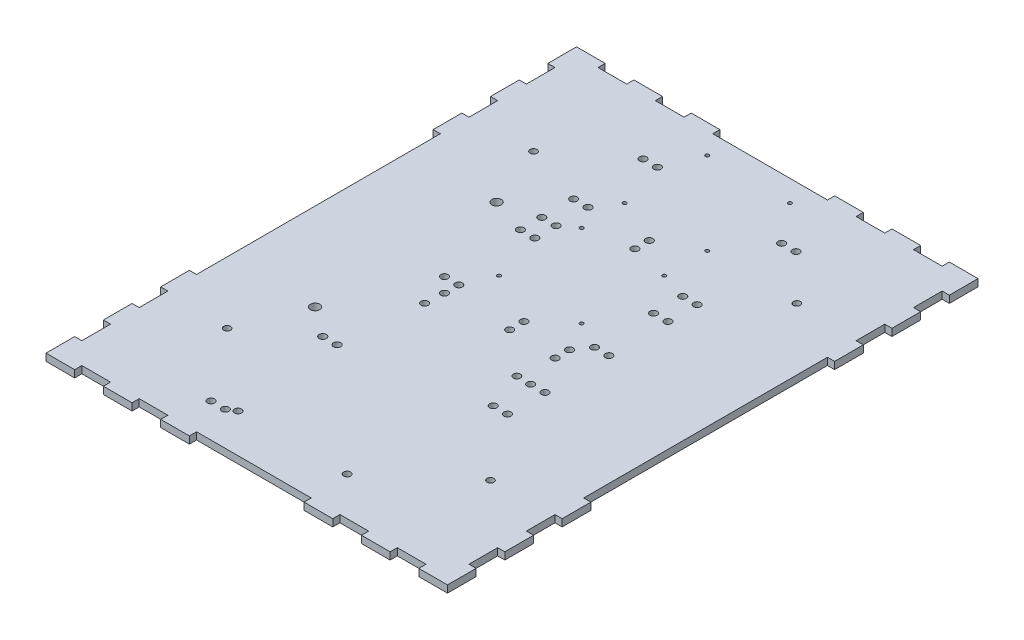
from build123d import *

# Parameters (mm, degrees)
BOSS_EXTRUDE1_DEPTH     = 3.175
CUT_EXTRUDE1_DEPTH      = 295.659843082
CUT_EXTRUDE1_DEPTH_BACK = 3.175
SKETCH2_R               = 1.524
SKETCH3_R               = 0.8
CUT_EXTRUDE2_DEPTH      = 5.715
SKETCH4_R               = 1.5621
CUT_EXTRUDE3_DEPTH      = 10.16
SKETCH5_W               = 50.8
SKETCH5_H               = 3.175
SKETCH5_W_2             = 12.7
CUT_EXTRUDE4_DEPTH      = 7.62
SKETCH7_R               = 2.0955
CUT_EXTRUDE5_DEPTH      = 7.62
SKETCH17_R              = 1.5875
CUT_EXTRUDE6_DEPTH      = 2.54


with BuildPart() as part:
    # Sketch1 → Boss-Extrude1 (new body)
    with BuildSketch(Plane(origin=(0, 0, 0), x_dir=(1, 0, 0), z_dir=(0, 1, 0))):
        Polygon((3.175, 209.55), (0, 209.55), (0, 196.85), (3.175, 196.85), (3.175, 184.15), (0, 184.15), (0, 171.45), (3.175, 171.45), (3.175, 63.5), (0, 63.5), (0, 50.8), (3.175, 50.8), (3.175, 38.1), (0, 38.1), (0, 25.4), (3.175, 25.4), (3.175, 12.7), (0, 12.7), (0, 0), (177.8, 0), (177.8, 12.7), (174.625, 12.7), (174.625, 25.4), (177.8, 25.4), (177.8, 38.1), (174.625, 38.1), (174.625, 50.8), (177.8, 50.8), (177.8, 63.5), (174.625, 63.5), (174.625, 171.45), (177.8, 171.45), (177.8, 184.15), (174.625, 184.15), (174.625, 196.85), (177.8, 196.85), (177.8, 209.55), (174.625, 209.55), (174.625, 222.25), (177.8, 222.25), (177.8, 234.95), (0, 234.95), (0, 222.25), (3.175, 222.25), align=None)
    extrude(amount=BOSS_EXTRUDE1_DEPTH)

    # Sketch2 → Cut-Extrude1 (cut, two sides: drawn at the far end of the back side and taken through both)
    with BuildSketch(Plane(origin=(0, 3.175, 0), x_dir=(1, 0, 0), z_dir=(0, 1, 0)).offset(-CUT_EXTRUDE1_DEPTH_BACK)):
        with Locations((30.5816, 49.6316)):
            Circle(SKETCH2_R)
        with Locations((30.5816, 185.3184)):
            Circle(SKETCH2_R)
        with Locations((147.2184, 49.6316)):
            Circle(SKETCH2_R)
        with Locations((147.2184, 185.3184)):
            Circle(SKETCH2_R)
    extrude(amount=CUT_EXTRUDE1_DEPTH + CUT_EXTRUDE1_DEPTH_BACK, mode=Mode.SUBTRACT)

    # Sketch3 → Cut-Extrude2 (cut)
    with BuildSketch(Plane(origin=(0, 3.175, 0), x_dir=(1, 0, 0), z_dir=(0, 1, 0))):
        with Locations((70.6, 222.25)):
            Circle(SKETCH3_R)
        with Locations((107.2, 222.25)):
            Circle(SKETCH3_R)
        with Locations((70.6, 185.65)):
            Circle(SKETCH3_R)
        with Locations((107.2, 185.65)):
            Circle(SKETCH3_R)
        with Locations((70.6, 166.6)):
            Circle(SKETCH3_R)
        with Locations((107.2, 166.6)):
            Circle(SKETCH3_R)
        with Locations((70.6, 130)):
            Circle(SKETCH3_R)
        with Locations((107.2, 130)):
            Circle(SKETCH3_R)
    extrude(amount=-CUT_EXTRUDE2_DEPTH, mode=Mode.SUBTRACT)

    # Sketch4 → Cut-Extrude3 (cut)
    with BuildSketch(Plane(origin=(0, 3.175, 0), x_dir=(1, 0, 0), z_dir=(0, 1, 0))):
        with Locations((64.7319, 20.32)):
            Circle(SKETCH4_R)
        with Locations((113.0681, 20.32)):
            Circle(SKETCH4_R)
        with Locations((64.7319, 102.9462)):
            Circle(SKETCH4_R)
        with Locations((113.0681, 95.4532)):
            Circle(SKETCH4_R)
    extrude(amount=-CUT_EXTRUDE3_DEPTH, mode=Mode.SUBTRACT)

    # Sketch5 → Cut-Extrude4 (cut)
    with BuildSketch(Plane(origin=(0, 3.175, 0), x_dir=(1, 0, 0), z_dir=(0, 1, 0))):
        with Locations((88.9, 1.5875)):
            Rectangle(SKETCH5_W, SKETCH5_H)
        with Locations((44.45, 1.5875)):
            Rectangle(SKETCH5_W_2, SKETCH5_H)
        with Locations((133.35, 1.5875)):
            Rectangle(SKETCH5_W_2, SKETCH5_H)
        with Locations((19.05, 1.5875)):
            Rectangle(SKETCH5_W_2, SKETCH5_H)
        with Locations((158.75, 1.5875)):
            Rectangle(SKETCH5_W_2, SKETCH5_H)
    cut_extrude4 = extrude(amount=-CUT_EXTRUDE4_DEPTH, mode=Mode.SUBTRACT)

    # Mirror1: Cut-Extrude4 across plane
    add(cut_extrude4.mirror(Plane.XY.offset(-117.475)), mode=Mode.SUBTRACT)

    # Sketch7 → Cut-Extrude5 (cut)
    with BuildSketch(Plane.XZ):
        with Locations((41.8719, -77.2795)):
            Circle(SKETCH7_R)
        with Locations((41.8719, -157.6705)):
            Circle(SKETCH7_R)
    extrude(amount=-CUT_EXTRUDE5_DEPTH, mode=Mode.SUBTRACT)

    # Sketch17 → Cut-Extrude6 (cut)
    with BuildSketch(Plane(origin=(0, 3.175, 0), x_dir=(1, 0, 0), z_dir=(0, 1, 0))):
        with BuildLine():
            Line((120.799052507, 95.094247774), (120.799052507, 95.709089848))
            ThreePointArc((120.799052507, 95.709089848), (117.654103131, 95.401668811), (120.799052507, 95.094247774))
        make_face()
        with Locations((57.739897204, 175.943534823)):
            Circle(SKETCH17_R)
        with Locations((57.739897204, 161.824089124)):
            Circle(SKETCH17_R)
        with Locations((57.739897204, 152.385453081)):
            Circle(SKETCH17_R)
        with Locations((58.896740906, 117.568486571)):
            Circle(SKETCH17_R)
        with BuildLine():
            ThreePointArc((120.799052507, 163.067565866), (117.654103131, 162.760144829), (120.799052507, 162.452723792))
            Line((120.799052507, 162.452723792), (120.799052507, 163.067565866))
        make_face()
        with BuildLine():
            ThreePointArc((120.799052507, 123.985665556), (117.654103131, 123.678244519), (120.799052507, 123.370823482))
            Line((120.799052507, 123.370823482), (120.799052507, 123.985665556))
        make_face()
        with BuildLine():
            Line((120.799052507, 149.517165239), (120.799052507, 150.132007312))
            ThreePointArc((120.799052507, 150.132007312), (117.654103131, 149.824586276), (120.799052507, 149.517165239))
        make_face()
        with Locations((65.246740906, 117.568486571)):
            Circle(SKETCH17_R)
        with Locations((65.246740906, 111.218486571)):
            Circle(SKETCH17_R)
        with Locations((114.648189497, 117.190212923)):
            Circle(SKETCH17_R)
        with Locations((114.648189497, 110.840212923)):
            Circle(SKETCH17_R)
        with Locations((125.591603131, 123.678244519)):
            Circle(SKETCH17_R)
        with Locations((125.591603131, 149.824586276)):
            Circle(SKETCH17_R)
        with Locations((125.591603131, 162.760144829)):
            Circle(SKETCH17_R)
        with Locations((127.149052507, 205.003204515)):
            Circle(SKETCH17_R)
        with Locations((120.799052507, 205.003204515)):
            Circle(SKETCH17_R)
        with Locations((64.089897204, 206.696000808)):
            Circle(SKETCH17_R)
        with Locations((57.739897204, 206.696000808)):
            Circle(SKETCH17_R)
        with Locations((64.089897204, 175.943534823)):
            Circle(SKETCH17_R)
        with Locations((64.089897204, 152.385453081)):
            Circle(SKETCH17_R)
        with Locations((64.089897204, 161.824089124)):
            Circle(SKETCH17_R)
        with Locations((61.242736713, 67.658137045)):
            Circle(SKETCH17_R)
        with Locations((54.892736713, 67.658137045)):
            Circle(SKETCH17_R)
        with Locations((125.591603131, 95.401668811)):
            Circle(SKETCH17_R)
        with Locations((125.591603131, 78.821214915)):
            Circle(SKETCH17_R)
        with Locations((119.241603131, 78.821214915)):
            Circle(SKETCH17_R)
        with Locations((61.242736713, 18.183445603)):
            Circle(SKETCH17_R)
        with Locations((54.892736713, 18.183445603)):
            Circle(SKETCH17_R)
        with Locations((90.400211198, 176.752819795)):
            Circle(SKETCH17_R)
        with Locations((90.400211198, 170.402819795)):
            Circle(SKETCH17_R)
        with Locations((93.718657531, 117.961777818)):
            Circle(SKETCH17_R)
        with Locations((93.718657531, 111.611777818)):
            Circle(SKETCH17_R)
    extrude(amount=-CUT_EXTRUDE6_DEPTH, mode=Mode.SUBTRACT)


solid = part.part
